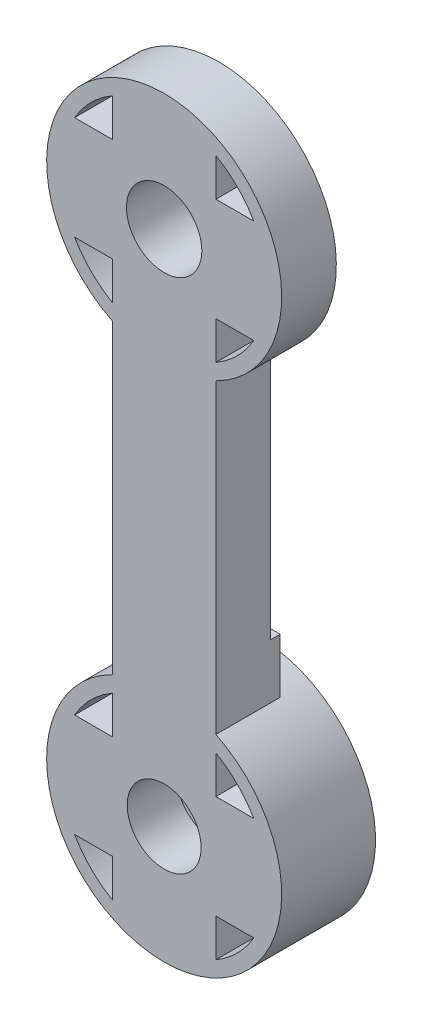
from build123d import *
from build123d.topology import SkipClean

# Parameters (mm, degrees)
SKETCH1_R               = 1.5
BOSS_EXTRUDE4_DEPTH     = 3
BOSS_EXTRUDE5_START     = 3
SKETCH3_R               = 7.95
SKETCH3_R_2             = 1.5
BOSS_EXTRUDE5_DEPTH     = 3
SKETCH4_R               = 2.5
CUT_EXTRUDE1_DEPTH      = 1.5
SKETCH5_R               = 7
CUT_EXTRUDE2_DEPTH      = 2
SKETCH6_R               = 7.95
CUT_EXTRUDE3_DEPTH      = 1
SKETCH7_R               = 2.5
CUT_EXTRUDE4_DEPTH      = 1.85
BOSS_EXTRUDE6_START     = 0.7
SKETCH8_R               = 7.95
SKETCH8_R_2             = 7
BOSS_EXTRUDE6_DEPTH     = 0.7
BOSS_EXTRUDE8_START     = 0.7
SKETCH9_R               = 7.95
SKETCH9_R_2             = 1.5
BOSS_EXTRUDE8_DEPTH     = 0.7
BOSS_EXTRUDE9_START     = 0.7
BOSS_EXTRUDE9_DEPTH     = 0.7
CUT_EXTRUDE5_DEPTH      = 45.603755447
CUT_EXTRUDE5_DEPTH_BACK = 45.603755447
SKETCH11_W              = 3
SKETCH11_H              = 15.9
SKETCH11_W_2            = 2
BOSS_EXTRUDE10_START    = 0.65
BOSS_EXTRUDE10_DEPTH    = 0.65
BOSS_EXTRUDE11_START    = 2.65
SKETCH13_R              = 7.95
SKETCH13_R_2            = 1.5
BOSS_EXTRUDE11_DEPTH    = 2.65
SKETCH14_R              = 2.55
CUT_EXTRUDE6_DEPTH      = 45.138730158


with BuildPart() as part:
    # Sketch1 → Boss-Extrude4 (new body)
    with BuildSketch(Plane.XY):
        with BuildLine():
            Line((-3.5, -7.138101989), (-3.5, -27.861898011))
            ThreePointArc((-3.5, -27.861898011), (0, -42.95), (3.5, -27.861898011))
            Line((3.5, -27.861898011), (3.5, -7.138101989))
            ThreePointArc((3.5, -7.138101989), (0, 7.95), (-3.5, -7.138101989))
        make_face()
        with BuildLine():
            Line((-3.5, 6.062177826), (-3.5, 3.5))
            Line((-3.5, 3.5), (-6.062177826, 3.5))
            ThreePointArc((-6.062177826, 3.5), (-4.949747468, 4.949747468), (-3.5, 6.062177826))
        make_face(mode=Mode.SUBTRACT)
        with BuildLine():
            Line((3.5, 3.5), (3.5, 6.062177826))
            ThreePointArc((3.5, 6.062177826), (4.949747468, 4.949747468), (6.062177826, 3.5))
            Line((6.062177826, 3.5), (3.5, 3.5))
        make_face(mode=Mode.SUBTRACT)
        Circle(SKETCH1_R, mode=Mode.SUBTRACT)
        with BuildLine():
            Line((-6.062177826, -3.5), (-3.5, -3.5))
            Line((-3.5, -3.5), (-3.5, -6.062177826))
            ThreePointArc((-3.5, -6.062177826), (-4.949747468, -4.949747468), (-6.062177826, -3.5))
        make_face(mode=Mode.SUBTRACT)
        with BuildLine():
            Line((3.5, -3.5), (6.062177826, -3.5))
            ThreePointArc((6.062177826, -3.5), (4.949747468, -4.949747468), (3.5, -6.062177826))
            Line((3.5, -6.062177826), (3.5, -3.5))
        make_face(mode=Mode.SUBTRACT)
        with BuildLine():
            ThreePointArc((3.5, -28.937822174), (4.949747468, -30.050252532), (6.062177826, -31.5))
            Line((6.062177826, -31.5), (3.5, -31.5))
            Line((3.5, -31.5), (3.5, -28.937822174))
        make_face(mode=Mode.SUBTRACT)
        with BuildLine():
            Line((-3.5, -28.937822174), (-3.5, -31.5))
            Line((-3.5, -31.5), (-6.062177826, -31.5))
            ThreePointArc((-6.062177826, -31.5), (-4.949747468, -30.050252532), (-3.5, -28.937822174))
        make_face(mode=Mode.SUBTRACT)
        with BuildLine():
            ThreePointArc((-3.5, -41.062177826), (-4.949747468, -39.949747468), (-6.062177826, -38.5))
            Line((-6.062177826, -38.5), (-3.5, -38.5))
            Line((-3.5, -38.5), (-3.5, -41.062177826))
        make_face(mode=Mode.SUBTRACT)
        with BuildLine():
            ThreePointArc((6.062177826, -38.5), (4.949747468, -39.949747468), (3.5, -41.062177826))
            Line((3.5, -41.062177826), (3.5, -38.5))
            Line((3.5, -38.5), (6.062177826, -38.5))
        make_face(mode=Mode.SUBTRACT)
        with Locations((0, -35)):
            Circle(SKETCH1_R, mode=Mode.SUBTRACT)
    extrude(amount=BOSS_EXTRUDE4_DEPTH)

    # Sketch3 → Boss-Extrude5 (add)
    # profile 1 of 2: a face of its own
    with SkipClean():  # the faces are left unmerged after this step: merging them gives an invalid solid
        with BuildSketch(Plane(origin=(0, 0, 0), x_dir=(-1, 0, 0), z_dir=(0, 0, -1)).offset(BOSS_EXTRUDE5_START)):
            Circle(SKETCH3_R)
            with BuildLine():
                Line((3.5, 3.5), (3.5, 6.062177826))
                ThreePointArc((3.5, 6.062177826), (4.949747468, 4.949747468), (6.062177826, 3.5))
                Line((6.062177826, 3.5), (3.5, 3.5))
            make_face(mode=Mode.SUBTRACT)
            with BuildLine():
                Line((3.5, -3.5), (6.062177826, -3.5))
                ThreePointArc((6.062177826, -3.5), (4.949747468, -4.949747468), (3.5, -6.062177826))
                Line((3.5, -6.062177826), (3.5, -3.5))
            make_face(mode=Mode.SUBTRACT)
            with BuildLine():
                Line((-3.5, -3.5), (-3.5, -6.062177826))
                ThreePointArc((-3.5, -6.062177826), (-4.949747468, -4.949747468), (-6.062177826, -3.5))
                Line((-6.062177826, -3.5), (-3.5, -3.5))
            make_face(mode=Mode.SUBTRACT)
            with BuildLine():
                Line((-3.5, 3.5), (-6.062177826, 3.5))
                ThreePointArc((-6.062177826, 3.5), (-4.949747468, 4.949747468), (-3.5, 6.062177826))
                Line((-3.5, 6.062177826), (-3.5, 3.5))
            make_face(mode=Mode.SUBTRACT)
            Circle(SKETCH3_R_2, mode=Mode.SUBTRACT)
        # profile 2 of 2: a face of its own
        with BuildSketch(Plane(origin=(0, 0, 0), x_dir=(-1, 0, 0), z_dir=(0, 0, -1)).offset(BOSS_EXTRUDE5_START)):
            with Locations((0, -35)):
                Circle(SKETCH3_R)
            with BuildLine():
                Line((-3.5, -38.5), (-3.5, -41.062177826))
                ThreePointArc((-3.5, -41.062177826), (-4.949747468, -39.949747468), (-6.062177826, -38.5))
                Line((-6.062177826, -38.5), (-3.5, -38.5))
            make_face(mode=Mode.SUBTRACT)
            with BuildLine():
                Line((-3.5, -31.5), (-6.062177826, -31.5))
                ThreePointArc((-6.062177826, -31.5), (-4.949747468, -30.050252532), (-3.5, -28.937822174))
                Line((-3.5, -28.937822174), (-3.5, -31.5))
            make_face(mode=Mode.SUBTRACT)
            with BuildLine():
                Line((3.5, -31.5), (3.5, -28.937822174))
                ThreePointArc((3.5, -28.937822174), (4.949747468, -30.050252532), (6.062177826, -31.5))
                Line((6.062177826, -31.5), (3.5, -31.5))
            make_face(mode=Mode.SUBTRACT)
            with BuildLine():
                Line((3.5, -38.5), (6.062177826, -38.5))
                ThreePointArc((6.062177826, -38.5), (4.949747468, -39.949747468), (3.5, -41.062177826))
                Line((3.5, -41.062177826), (3.5, -38.5))
            make_face(mode=Mode.SUBTRACT)
            with Locations((0, -35)):
                Circle(SKETCH3_R_2, mode=Mode.SUBTRACT)
        extrude(amount=-BOSS_EXTRUDE5_DEPTH)

    # Sketch4 → Cut-Extrude1 (cut)
    with SkipClean():  # the faces are left unmerged after this step: merging them gives an invalid solid
        with BuildSketch(Plane.XY.offset(3)):
            with Locations((0, -35)):
                Circle(SKETCH4_R)
            Circle(SKETCH4_R)
        extrude(amount=-CUT_EXTRUDE1_DEPTH, mode=Mode.SUBTRACT)

    # Sketch5 → Cut-Extrude2 (cut)
    with SkipClean():  # the faces are left unmerged after this step: merging them gives an invalid solid
        with BuildSketch(Plane(origin=(0, 0, -3), x_dir=(-1, 0, 0), z_dir=(0, 0, -1))):
            Circle(SKETCH5_R)
        extrude(amount=-CUT_EXTRUDE2_DEPTH, mode=Mode.SUBTRACT)

    # Sketch6 → Cut-Extrude3 (cut)
    with SkipClean():  # the faces are left unmerged after this step: merging them gives an invalid solid
        with BuildSketch(Plane(origin=(0, 0, -3), x_dir=(-1, 0, 0), z_dir=(0, 0, -1))):
            with Locations((0, -35)):
                Circle(SKETCH6_R)
        extrude(amount=-CUT_EXTRUDE3_DEPTH, mode=Mode.SUBTRACT)

    # Sketch7 → Cut-Extrude4 (cut)
    with SkipClean():  # the faces are left unmerged after this step: merging them gives an invalid solid
        with BuildSketch(Plane.XY.offset(1.5)):
            with Locations((0, -35)):
                Circle(SKETCH7_R)
        extrude(amount=-CUT_EXTRUDE4_DEPTH, mode=Mode.SUBTRACT)

    # Sketch8 → Boss-Extrude6 (add)
    with BuildSketch(Plane(origin=(0, 0, -3), x_dir=(-1, 0, 0), z_dir=(0, 0, -1)).offset(BOSS_EXTRUDE6_START)):
        Circle(SKETCH8_R)
        Circle(SKETCH8_R_2, mode=Mode.SUBTRACT)
    extrude(amount=-BOSS_EXTRUDE6_DEPTH)

    # Sketch9 → Boss-Extrude8 (add)
    with SkipClean():  # the faces are left unmerged after this step: merging them gives an invalid solid
        with BuildSketch(Plane(origin=(0, 0, -2), x_dir=(-1, 0, 0), z_dir=(0, 0, -1)).offset(BOSS_EXTRUDE8_START)):
            with Locations((0, -35)):
                Circle(SKETCH9_R)
            with BuildLine():
                Line((3.5, -31.5), (3.5, -28.937822174))
                ThreePointArc((3.5, -28.937822174), (4.949747468, -30.050252532), (6.062177826, -31.5))
                Line((6.062177826, -31.5), (3.5, -31.5))
            make_face(mode=Mode.SUBTRACT)
            with BuildLine():
                Line((3.5, -38.5), (6.062177826, -38.5))
                ThreePointArc((6.062177826, -38.5), (4.949747468, -39.949747468), (3.5, -41.062177826))
                Line((3.5, -41.062177826), (3.5, -38.5))
            make_face(mode=Mode.SUBTRACT)
            with BuildLine():
                Line((-3.5, -38.5), (-3.5, -41.062177826))
                ThreePointArc((-3.5, -41.062177826), (-4.949747468, -39.949747468), (-6.062177826, -38.5))
                Line((-6.062177826, -38.5), (-3.5, -38.5))
            make_face(mode=Mode.SUBTRACT)
            with BuildLine():
                Line((-3.5, -31.5), (-6.062177826, -31.5))
                ThreePointArc((-6.062177826, -31.5), (-4.949747468, -30.050252532), (-3.5, -28.937822174))
                Line((-3.5, -28.937822174), (-3.5, -31.5))
            make_face(mode=Mode.SUBTRACT)
            with Locations((0, -35)):
                Circle(SKETCH9_R_2, mode=Mode.SUBTRACT)
        extrude(amount=-BOSS_EXTRUDE8_DEPTH)

    # Sketch10 → Boss-Extrude9 (add)
    with SkipClean():  # the faces are left unmerged after this step: merging them gives an invalid solid
        with BuildSketch(Plane(origin=(0, 0, 0), x_dir=(-1, 0, 0), z_dir=(0, 0, -1)).offset(BOSS_EXTRUDE9_START)):
            with BuildLine():
                ThreePointArc((3.5, -7.138101989), (0, -7.95), (-3.5, -7.138101989))
                Line((-3.5, -7.138101989), (-3.5, -27.861898011))
                ThreePointArc((-3.5, -27.861898011), (0, -27.05), (3.5, -27.861898011))
                Line((3.5, -27.861898011), (3.5, -7.138101989))
            make_face()
        extrude(amount=-BOSS_EXTRUDE9_DEPTH)

    # Sketch11 → Cut-Extrude5 (cut, two sides: drawn at the far end of the back side and taken through both)
    with SkipClean():  # the faces are left unmerged after this step: merging them gives an invalid solid
        with BuildSketch(Plane(origin=(3.5, 0, 0), x_dir=(0, 0, -1), z_dir=(1, 0, 0)).offset(-CUT_EXTRUDE5_DEPTH_BACK)):
            with Locations((2.2, 0)):
                Rectangle(SKETCH11_W, SKETCH11_H)
            with Locations((1.7, -35)):
                Rectangle(SKETCH11_W_2, SKETCH11_H)
        extrude(amount=CUT_EXTRUDE5_DEPTH + CUT_EXTRUDE5_DEPTH_BACK, mode=Mode.SUBTRACT)

    # Sketch12 → Boss-Extrude10 (add)
    with SkipClean():  # the faces are left unmerged after this step: merging them gives an invalid solid
        with BuildSketch(Plane(origin=(0, 0, -0.7), x_dir=(-1, 0, 0), z_dir=(0, 0, -1)).offset(BOSS_EXTRUDE10_START)):
            with BuildLine():
                Line((-3.5, -24.161898011), (-3.5, -27.861898011))
                ThreePointArc((-3.5, -27.861898011), (0, -27.05), (3.5, -27.861898011))
                Line((3.5, -27.861898011), (3.5, -24.161898011))
                Line((3.5, -24.161898011), (-3.5, -24.161898011))
            make_face()
        extrude(amount=-BOSS_EXTRUDE10_DEPTH)

    # Sketch13 → Boss-Extrude11 (add)
    with SkipClean():  # the faces are left unmerged after this step: merging them gives an invalid solid
        with BuildSketch(Plane(origin=(0, 0, -0.7), x_dir=(-1, 0, 0), z_dir=(0, 0, -1)).offset(BOSS_EXTRUDE11_START)):
            with Locations((0, -35)):
                Circle(SKETCH13_R)
            with BuildLine():
                Line((-3.5, -31.5), (-6.062177826, -31.5))
                ThreePointArc((-6.062177826, -31.5), (-4.949747468, -30.050252532), (-3.5, -28.937822174))
                Line((-3.5, -28.937822174), (-3.5, -31.5))
            make_face(mode=Mode.SUBTRACT)
            with BuildLine():
                Line((3.5, -31.5), (3.5, -28.937822174))
                ThreePointArc((3.5, -28.937822174), (4.949747468, -30.050252532), (6.062177826, -31.5))
                Line((6.062177826, -31.5), (3.5, -31.5))
            make_face(mode=Mode.SUBTRACT)
            with BuildLine():
                Line((3.5, -38.5), (6.062177826, -38.5))
                ThreePointArc((6.062177826, -38.5), (4.949747468, -39.949747468), (3.5, -41.062177826))
                Line((3.5, -41.062177826), (3.5, -38.5))
            make_face(mode=Mode.SUBTRACT)
            with BuildLine():
                Line((-3.5, -38.5), (-3.5, -41.062177826))
                ThreePointArc((-3.5, -41.062177826), (-4.949747468, -39.949747468), (-6.062177826, -38.5))
                Line((-6.062177826, -38.5), (-3.5, -38.5))
            make_face(mode=Mode.SUBTRACT)
            with Locations((0, -35)):
                Circle(SKETCH13_R_2, mode=Mode.SUBTRACT)
        extrude(amount=-BOSS_EXTRUDE11_DEPTH)

    # Sketch14 → Cut-Extrude6 (cut, through all)
    with SkipClean():  # the faces are left unmerged after this step: merging them gives an invalid solid
        with BuildSketch(Plane.XY.offset(3)):
            Circle(SKETCH14_R)
        extrude(amount=-CUT_EXTRUDE6_DEPTH, mode=Mode.SUBTRACT)


solid = part.part
